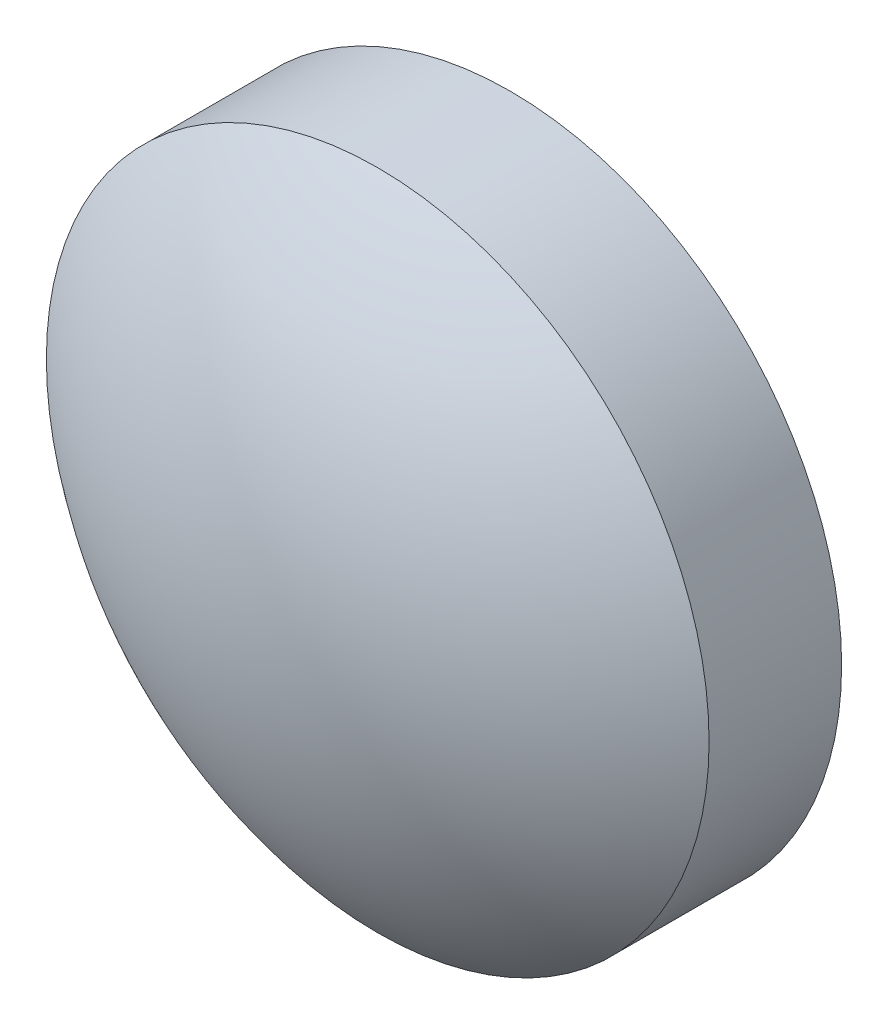
from build123d import *

# Parameters (mm, degrees)
SKETCH1_R           = 2.5
BOSS_EXTRUDE1_DEPTH = 1


with BuildPart() as part:
    # Sketch1 → Boss-Extrude1 (new body)
    with BuildSketch(Plane.XY):
        Circle(SKETCH1_R)
    extrude(amount=BOSS_EXTRUDE1_DEPTH)

    # Sketch4 → Revolve8 (revolve)
    with BuildSketch(Plane(origin=(0, 0, 0), x_dir=(1, 0, 0), z_dir=(0, 1, 0))):
        with BuildLine():
            Line((2.5, -1), (0, -1))
            Line((0, -1), (0, -1.888908989))
            ThreePointArc((0, -1.888908989), (1.326664915, -1.660069693), (2.5, -1))
        make_face()
    revolve(axis=Axis((0, 0, 1), (0, 0, 1)))


solid = part.part
